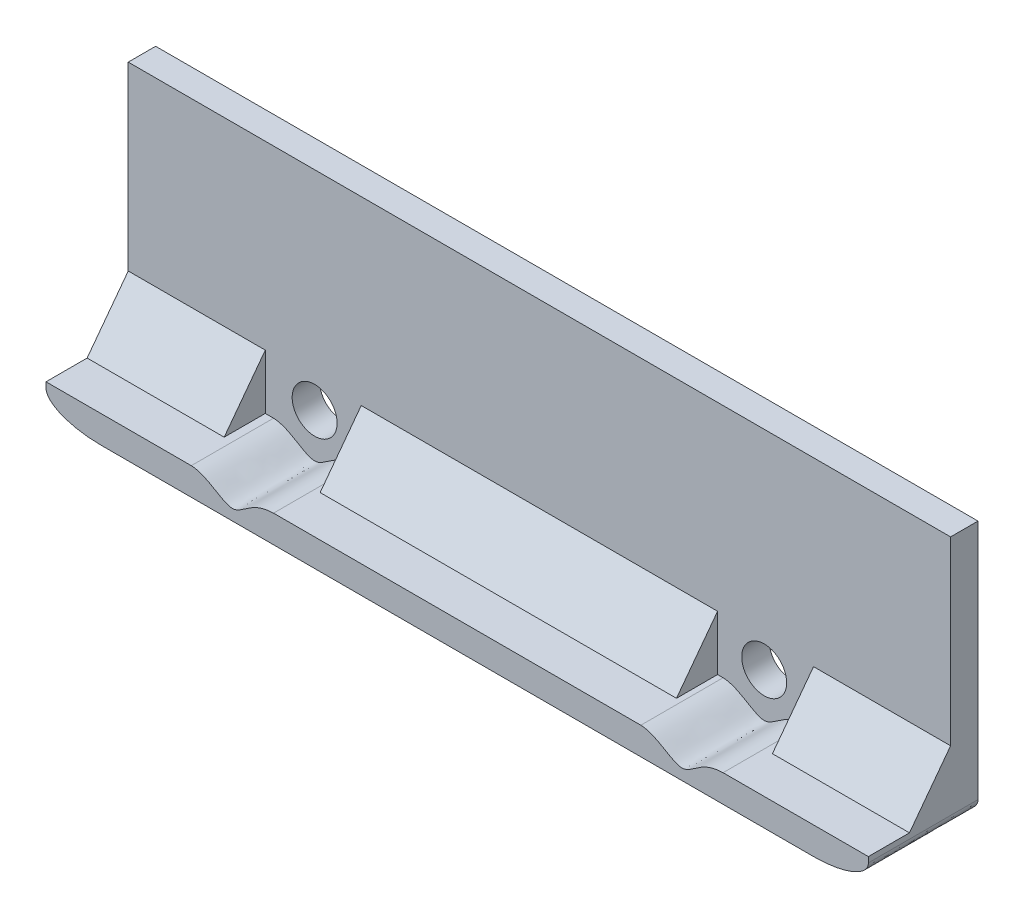
from build123d import *

# Parameters (mm, degrees)
SKETCH1_W           = 150
SKETCH1_H           = 48
SKETCH1_R           = 4.1
BOSS_EXTRUDE1_DEPTH = 5
BOSS_EXTRUDE2_DEPTH = 20
BOSS_EXTRUDE3_DEPTH = 25
BOSS_EXTRUDE4_START = -150
BOSS_EXTRUDE4_DEPTH = 25
BOSS_EXTRUDE5_START = -75
BOSS_EXTRUDE5_DEPTH = 32.5
FILLET5_SIZE        = 10
FILLET5_SIZE_2      = 4
FILLET6_SIZE        = 10
FILLET6_SIZE_2      = 4


with BuildPart() as part:
    # Sketch1 → Boss-Extrude1 (new body)
    with BuildSketch(Plane.XY):
        with Locations((0, 24)):
            Rectangle(SKETCH1_W, SKETCH1_H)
        with Locations((-41, 10)):
            Circle(SKETCH1_R, mode=Mode.SUBTRACT)
        with Locations((41, 10)):
            Circle(SKETCH1_R, mode=Mode.SUBTRACT)
    extrude(amount=BOSS_EXTRUDE1_DEPTH)

    # Sketch2 → Boss-Extrude2 (add)
    with BuildSketch(Plane.XY):
        with BuildLine():
            Line((-75, 5), (-75, 0))
            Line((-75, 0), (75, 0))
            Line((75, 0), (75, 5))
            Line((75, 5), (48.5, 5))
            add(Edge.make_bspline(
                [(33.5, 5), (36.476810307, 4.895138539), (41.670990079, -0.895128503), (44.181209535, 4.895118466), (48.5, 5)],
                knots=[0, 0, 0, 0, 0.5, 1, 1, 1, 1], degree=3))
            Line((33.5, 5), (-33.5, 5))
            add(Edge.make_bspline(
                [(-48.5, 5), (-45.523189693, 4.895138539), (-40.329009921, -0.895128503), (-37.818790465, 4.895118466), (-33.5, 5)],
                knots=[0, 0, 0, 0, 0.5, 1, 1, 1, 1], degree=3))
            Line((-48.5, 5), (-75, 5))
        make_face()
    extrude(amount=BOSS_EXTRUDE2_DEPTH)

    # Sketch4 → Boss-Extrude3 (add)
    with BuildSketch(Plane.ZY.offset(75)):
        Polygon((5, 5), (12.5, 5), (5, 15), align=None)
    extrude(amount=-BOSS_EXTRUDE3_DEPTH)

    # Sketch4<2> → Boss-Extrude4 (add)
    with BuildSketch(Plane.ZY.offset(75).offset(BOSS_EXTRUDE4_START)):
        Polygon((5, 5), (12.5, 5), (5, 15), align=None)
    extrude(amount=BOSS_EXTRUDE4_DEPTH)

    # Sketch4<3> → Boss-Extrude5 (add, symmetric)
    with BuildSketch(Plane.ZY.offset(75).offset(BOSS_EXTRUDE5_START)):
        Polygon((5, 5), (12.5, 5), (5, 15), align=None)
    extrude(amount=BOSS_EXTRUDE5_DEPTH, both=True)

    # Fillet5
    # an asymmetric fillet: 10, 4 mm, written as the material it takes off along each edge
    with BuildSketch(Plane(origin=(-75, 0, 45), x_dir=(1, 0, 0), z_dir=(0, 0, -1))) as fillet5_piece_1:
        with BuildLine():
            Bezier((FILLET5_SIZE, 0), (0, 0), (0, -FILLET5_SIZE_2), weights=[1, 0.707106781, 1])
            Line((0, -FILLET5_SIZE_2), (0, 0))
            Line((0, 0), (FILLET5_SIZE, 0))
        make_face()
    extrude(amount=70, mode=Mode.SUBTRACT)

    # Fillet6
    # an asymmetric fillet: 10, 4 mm, written as the material it takes off along each edge
    with BuildSketch(Plane(origin=(75, 0, -25), x_dir=(-1, 0, 0), z_dir=(0, 0, 1))) as fillet6_piece_1:
        with BuildLine():
            Bezier((FILLET6_SIZE, 0), (0, 0), (0, -FILLET6_SIZE_2), weights=[1, 0.707106781, 1])
            Line((0, -FILLET6_SIZE_2), (0, 0))
            Line((0, 0), (FILLET6_SIZE, 0))
        make_face()
    extrude(amount=70, mode=Mode.SUBTRACT)


solid = part.part
